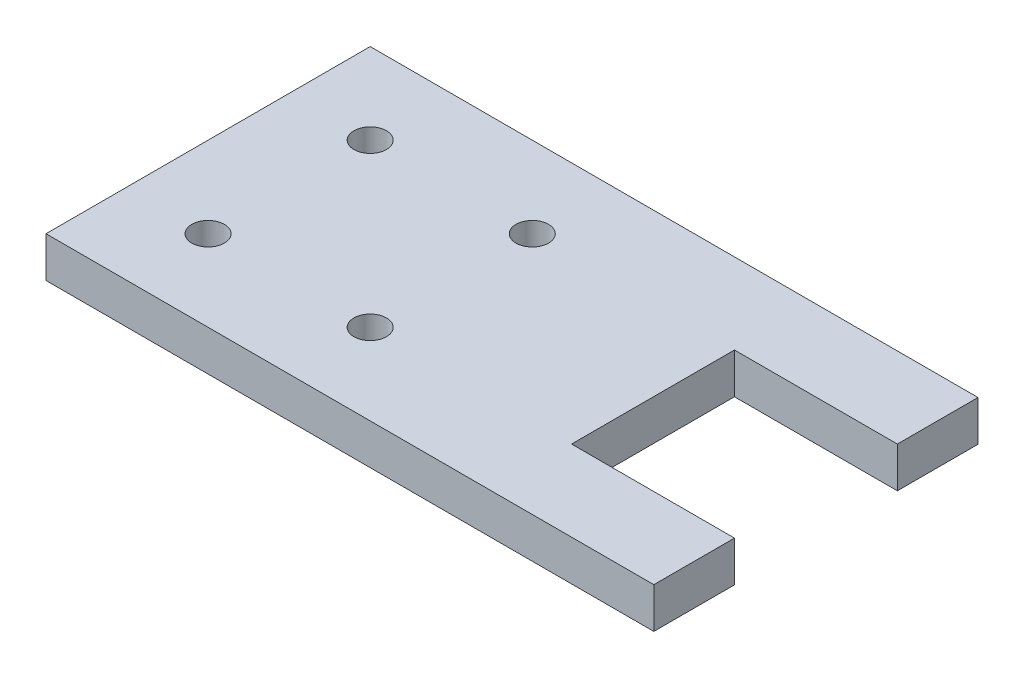
from build123d import *

# Parameters (mm, degrees)
BOSS_EXTRUDE1_DEPTH    = 6.35
F_10_CLEARANCE_HOLE1_D = 5.1054
SKETCH5_W              = 25.527
SKETCH5_H              = 25.527
CUT_EXTRUDE1_DEPTH     = 66.761600688


with BuildPart() as part:
    # Sketch1 → Boss-Extrude1 (new body)
    with BuildSketch(Plane(origin=(0, 0, 0), x_dir=(1, 0, 0), z_dir=(0, 1, 0))):
        Polygon((34.925, 25.4), (60.325, 25.4), (60.325, -25.4), (34.925, -25.4), (-34.925, -25.4), (-34.925, 25.4), align=None)
    extrude(amount=BOSS_EXTRUDE1_DEPTH)

    # #10 Clearance Hole1 (through all)
    with Locations(Plane(origin=(0, 6.35, 0), x_dir=(1, 0, 0), z_dir=(0, 1, 0))):
        with Locations((-22.225, 12.7), (3.175, 12.7), (3.175, -12.7), (-22.225, -12.7)):
            Hole(F_10_CLEARANCE_HOLE1_D / 2)

    # Sketch5 → Cut-Extrude1 (cut, through all)
    with BuildSketch(Plane(origin=(0, 6.35, 0), x_dir=(1, 0, 0), z_dir=(0, 1, 0))):
        with Locations((47.5615, 0)):
            Rectangle(SKETCH5_W, SKETCH5_H)
    extrude(amount=-CUT_EXTRUDE1_DEPTH, mode=Mode.SUBTRACT)


solid = part.part
